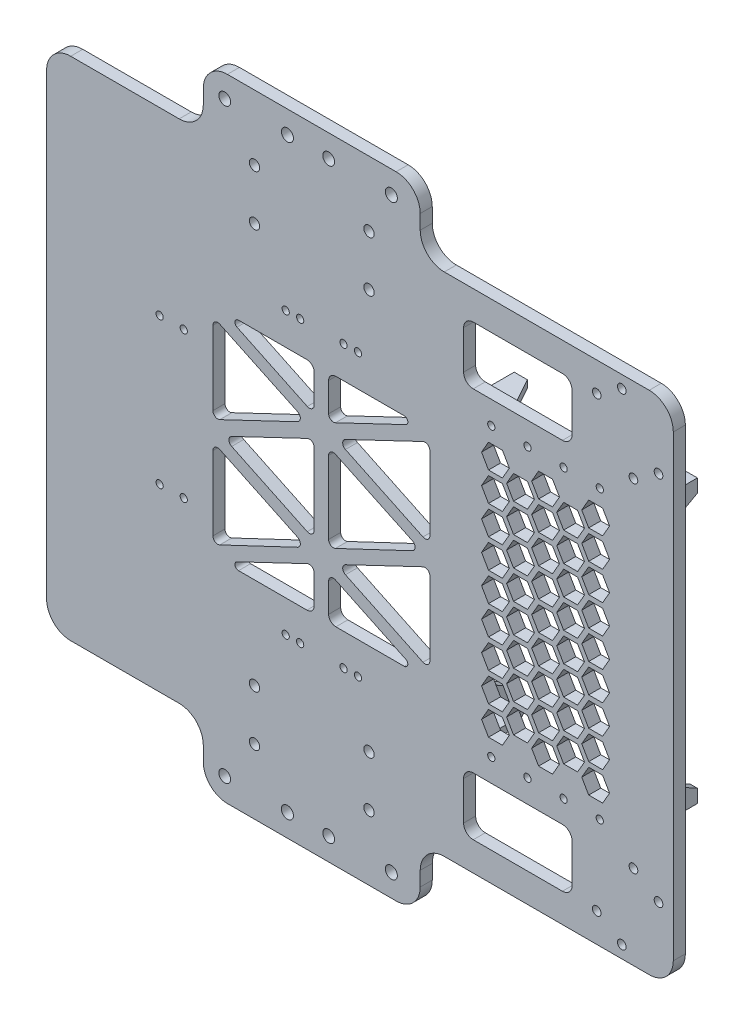
from build123d import *

# Parameters (mm, degrees)
EXTRUDE_1_DEPTH       = 5
EXTRUDE_2_DEPTH       = 20
CUT_EXTRUDE_3_DEPTH   = 10
CUT_EXTRUDE_4_DEPTH   = 10
MIRROR_2_COPY_1_DEPTH = 20
MIRROR_2_COPY_2_DEPTH = 10
MIRROR_2_COPY_3_DEPTH = 10
MIRROR_2_COPY_4_DEPTH = 20
MIRROR_2_COPY_5_DEPTH = 10
MIRROR_2_COPY_6_DEPTH = 10
CUT_EXTRUDE_5_DEPTH   = 5
SKETCH_9_W            = 45
SKETCH_9_H            = 24
CUT_EXTRUDE_6_DEPTH   = 5
FILLET_1_R            = 4
FILLET_2_R            = 1.5
FILLET_3_R            = 2
FILLET_4_R            = 3
SKETCH_10_R           = 1.8
SKETCH_10_R_2         = 2.5
SKETCH_10_R_3         = 2.45
SKETCH_10_R_4         = 1.5
SKETCH_10_R_5         = 2.15
CUT_EXTRUDE_7_DEPTH   = 186.636742053


with BuildPart() as part:
    # 草图1 → 凸台-拉伸1 (new body)
    with BuildSketch(Plane.XY):
        with BuildLine():
            Line((-130, 95), (-130, -95))
            ThreePointArc((-130, -95), (-127.071067812, -102.071067812), (-120, -105))
            Line((-120, -105), (-75, -105))
            ThreePointArc((-75, -105), (-67.928932188, -107.928932188), (-65, -115))
            Line((-65, -115), (-65, -121))
            ThreePointArc((-65, -121), (-62.071067812, -128.071067812), (-55, -131))
            Line((-55, -131), (15, -131))
            ThreePointArc((15, -131), (22.071067812, -128.071067812), (25, -121))
            Line((25, -121), (25, -115))
            ThreePointArc((25, -115), (27.928932188, -107.928932188), (35, -105))
            Line((35, -105), (120, -105))
            ThreePointArc((120, -105), (127.071067812, -102.071067812), (130, -95))
            Line((130, -95), (130, 95))
            ThreePointArc((130, 95), (127.071067812, 102.071067812), (120, 105))
            Line((120, 105), (35, 105))
            ThreePointArc((35, 105), (27.928932188, 107.928932188), (25, 115))
            Line((25, 115), (25, 121))
            ThreePointArc((25, 121), (22.071067812, 128.071067812), (15, 131))
            Line((15, 131), (-55, 131))
            ThreePointArc((-55, 131), (-62.071067812, 128.071067812), (-65, 121))
            Line((-65, 121), (-65, 115))
            ThreePointArc((-65, 115), (-67.928932188, 107.928932188), (-75, 105))
            Line((-75, 105), (-120, 105))
            ThreePointArc((-120, 105), (-127.071067812, 102.071067812), (-130, 95))
        make_face()
    extrude(amount=EXTRUDE_1_DEPTH)

    # 草图4 → 凸台-拉伸2 (add)
    with BuildSketch(Plane(origin=(0, 0, 0), x_dir=(-1, 0, 0), z_dir=(0, 0, -1))):
        Polygon((-39, -47.5), (-39, -58.5), (-50, -58.5), (-50, -55.5), (-42, -55.5), (-42, -47.5), align=None)
    extrude_2 = extrude(amount=EXTRUDE_2_DEPTH)

    # 草图5 → 切除-拉伸3 (cut)
    with BuildSketch(Plane.XZ.offset(58.5)):
        Polygon((50, -10), (44.5, -20), (50, -20), align=None)
    cut_extrude_3 = extrude(amount=-CUT_EXTRUDE_3_DEPTH, mode=Mode.SUBTRACT)

    # 草图6 → 切除-拉伸4 (cut)
    with BuildSketch(Plane.ZY.offset(-39)):
        Polygon((-20, -53), (-10, -47.5), (-20, -47.5), align=None)
    cut_extrude_4 = extrude(amount=-CUT_EXTRUDE_4_DEPTH, mode=Mode.SUBTRACT)

    # 镜向1: 凸台-拉伸2, 切除-拉伸3, 切除-拉伸4 across plane
    add(extrude_2.mirror(Plane(origin=(77, 0, 0), x_dir=(0, 0, 1), z_dir=(1, 0, 0))))
    add(cut_extrude_3.mirror(Plane(origin=(77, 0, 0), x_dir=(0, 0, 1), z_dir=(1, 0, 0))), mode=Mode.SUBTRACT)
    add(cut_extrude_4.mirror(Plane(origin=(77, 0, 0), x_dir=(0, 0, 1), z_dir=(1, 0, 0))), mode=Mode.SUBTRACT)

    # 镜向2 copy 1 sketch → 镜向2 copy 1 (add)
    with BuildSketch(Plane(origin=(154, 0, 0), x_dir=(1, 0, 0), z_dir=(0, 0, -1))):
        Polygon((-39, -47.5), (-39, -58.5), (-50, -58.5), (-50, -55.5), (-42, -55.5), (-42, -47.5), align=None)
    extrude(amount=MIRROR_2_COPY_1_DEPTH)

    # 镜向2 copy 2 sketch → 镜向2 copy 2 (cut)
    with BuildSketch(Plane(origin=(154, 58.5, 0), x_dir=(-1, 0, 0), z_dir=(0, 1, 0))):
        Polygon((50, -10), (44.5, -20), (50, -20), align=None)
    extrude(amount=-MIRROR_2_COPY_2_DEPTH, mode=Mode.SUBTRACT)

    # 镜向2 copy 3 sketch → 镜向2 copy 3 (cut)
    with BuildSketch(Plane(origin=(115, 0, 0), x_dir=(0, 0, 1), z_dir=(1, 0, 0))):
        Polygon((-20, -53), (-10, -47.5), (-20, -47.5), align=None)
    extrude(amount=-MIRROR_2_COPY_3_DEPTH, mode=Mode.SUBTRACT)

    # 镜向2 copy 4 sketch → 镜向2 copy 4 (add)
    with BuildSketch(Plane(origin=(0, 0, 0), x_dir=(-1, 0, 0), z_dir=(0, 0, -1))):
        Polygon((-39, 47.5), (-39, 58.5), (-50, 58.5), (-50, 55.5), (-42, 55.5), (-42, 47.5), align=None)
    extrude(amount=MIRROR_2_COPY_4_DEPTH)

    # 镜向2 copy 5 sketch → 镜向2 copy 5 (cut)
    with BuildSketch(Plane(origin=(0, 58.5, 0), x_dir=(1, 0, 0), z_dir=(0, 1, 0))):
        Polygon((50, 10), (44.5, 20), (50, 20), align=None)
    extrude(amount=-MIRROR_2_COPY_5_DEPTH, mode=Mode.SUBTRACT)

    # 镜向2 copy 6 sketch → 镜向2 copy 6 (cut)
    with BuildSketch(Plane.ZY.offset(-39)):
        Polygon((-20, 53), (-10, 47.5), (-20, 47.5), align=None)
    extrude(amount=-MIRROR_2_COPY_6_DEPTH, mode=Mode.SUBTRACT)

    # 草图7 → 切除-拉伸5 (cut)
    with BuildSketch(Plane(origin=(0, 0, 0), x_dir=(-1, 0, 0), z_dir=(0, 0, -1))):
        Polygon((-92.012994616, 36), (-94.899745962, 41), (-100.673248654, 41), (-103.56, 36), (-100.673248654, 31), (-94.899745962, 31), align=None)
        Polygon((-74.115136271, 31), (-71.228384925, 36), (-74.115136271, 41), (-79.888638963, 41), (-82.775390309, 36), (-79.888638963, 31), align=None)
        Polygon((-92.012994616, 24), (-94.899745962, 29), (-100.673248654, 29), (-103.56, 24), (-100.673248654, 19), (-94.899745962, 19), align=None)
        Polygon((-93.167695155, 30), (-90.280943809, 25), (-84.507441117, 25), (-81.620689771, 30), (-84.507441117, 35), (-90.280943809, 35), align=None)
        Polygon((-84.507441117, 37), (-81.620689771, 42), (-84.507441117, 47), (-90.280943809, 47), (-93.167695155, 42), (-90.280943809, 37), align=None)
        Polygon((-79.888638963, 43), (-74.115136271, 43), (-71.228384925, 48), (-74.115136271, 53), (-79.888638963, 53), (-82.775390309, 48), align=None)
        Polygon((-94.899745962, 43), (-92.012994616, 48), (-94.899745962, 53), (-100.673248654, 53), (-103.56, 48), (-100.673248654, 43), align=None)
        Polygon((-72.383085464, 42), (-69.496334118, 37), (-63.722831426, 37), (-60.83608008, 42), (-63.722831426, 47), (-69.496334118, 47), align=None)
        Polygon((-93.167695155, 18), (-90.280943809, 13), (-84.507441117, 13), (-81.620689771, 18), (-84.507441117, 23), (-90.280943809, 23), align=None)
        Polygon((-74.115136271, 19), (-71.228384925, 24), (-74.115136271, 29), (-79.888638963, 29), (-82.775390309, 24), (-79.888638963, 19), align=None)
        Polygon((-72.383085464, 30), (-69.496334118, 25), (-63.722831426, 25), (-60.83608008, 30), (-63.722831426, 35), (-69.496334118, 35), align=None)
        Polygon((-92.012994616, 12), (-94.899745962, 17), (-100.673248654, 17), (-103.56, 12), (-100.673248654, 7), (-94.899745962, 7), align=None)
        Polygon((-93.167695155, 6), (-90.280943809, 1), (-84.507441117, 1), (-81.620689771, 6), (-84.507441117, 11), (-90.280943809, 11), align=None)
        Polygon((-74.115136271, 7), (-71.228384925, 12), (-74.115136271, 17), (-79.888638963, 17), (-82.775390309, 12), (-79.888638963, 7), align=None)
        Polygon((-72.383085464, 18), (-69.496334118, 13), (-63.722831426, 13), (-60.83608008, 18), (-63.722831426, 23), (-69.496334118, 23), align=None)
        Polygon((-92.012994616, 0), (-94.899745962, 5), (-100.673248654, 5), (-103.56, 0), (-100.673248654, -5), (-94.899745962, -5), align=None)
        Polygon((-93.167695155, -6), (-90.280943809, -11), (-84.507441117, -11), (-81.620689771, -6), (-84.507441117, -1), (-90.280943809, -1), align=None)
        Polygon((-74.115136271, -5), (-71.228384925, 0), (-74.115136271, 5), (-79.888638963, 5), (-82.775390309, 0), (-79.888638963, -5), align=None)
        Polygon((-72.383085464, 6), (-69.496334118, 1), (-63.722831426, 1), (-60.83608008, 6), (-63.722831426, 11), (-69.496334118, 11), align=None)
        Polygon((-92.012994616, -12), (-94.899745962, -7), (-100.673248654, -7), (-103.56, -12), (-100.673248654, -17), (-94.899745962, -17), align=None)
        Polygon((-93.167695155, -18), (-90.280943809, -23), (-84.507441117, -23), (-81.620689771, -18), (-84.507441117, -13), (-90.280943809, -13), align=None)
        Polygon((-74.115136271, -17), (-71.228384925, -12), (-74.115136271, -7), (-79.888638963, -7), (-82.775390309, -12), (-79.888638963, -17), align=None)
        Polygon((-72.383085464, -6), (-69.496334118, -11), (-63.722831426, -11), (-60.83608008, -6), (-63.722831426, -1), (-69.496334118, -1), align=None)
        Polygon((-92.012994616, -24), (-94.899745962, -19), (-100.673248654, -19), (-103.56, -24), (-100.673248654, -29), (-94.899745962, -29), align=None)
        Polygon((-93.167695155, -30), (-90.280943809, -35), (-84.507441117, -35), (-81.620689771, -30), (-84.507441117, -25), (-90.280943809, -25), align=None)
        Polygon((-74.115136271, -29), (-71.228384925, -24), (-74.115136271, -19), (-79.888638963, -19), (-82.775390309, -24), (-79.888638963, -29), align=None)
        Polygon((-72.383085464, -18), (-69.496334118, -23), (-63.722831426, -23), (-60.83608008, -18), (-63.722831426, -13), (-69.496334118, -13), align=None)
        Polygon((-92.012994616, -36), (-94.899745962, -31), (-100.673248654, -31), (-103.56, -36), (-100.673248654, -41), (-94.899745962, -41), align=None)
        Polygon((-93.167695155, -42), (-90.280943809, -47), (-84.507441117, -47), (-81.620689771, -42), (-84.507441117, -37), (-90.280943809, -37), align=None)
        Polygon((-74.115136271, -41), (-71.228384925, -36), (-74.115136271, -31), (-79.888638963, -31), (-82.775390309, -36), (-79.888638963, -41), align=None)
        Polygon((-72.383085464, -30), (-69.496334118, -35), (-63.722831426, -35), (-60.83608008, -30), (-63.722831426, -25), (-69.496334118, -25), align=None)
        Polygon((-92.012994616, -48), (-94.899745962, -43), (-100.673248654, -43), (-103.56, -48), (-100.673248654, -53), (-94.899745962, -53), align=None)
        Polygon((-74.115136271, -53), (-71.228384925, -48), (-74.115136271, -43), (-79.888638963, -43), (-82.775390309, -48), (-79.888638963, -53), align=None)
        Polygon((-72.383085464, -42), (-69.496334118, -47), (-63.722831426, -47), (-60.83608008, -42), (-63.722831426, -37), (-69.496334118, -37), align=None)
        Polygon((-61.990780618, 36), (-59.104029272, 31), (-53.330526581, 31), (-50.443775235, 36), (-53.330526581, 41), (-59.104029272, 41), align=None)
        Polygon((-61.990780618, 48), (-59.104029272, 43), (-53.330526581, 43), (-50.443775235, 48), (-53.330526581, 53), (-59.104029272, 53), align=None)
        Polygon((-61.990780618, 24), (-59.104029272, 19), (-53.330526581, 19), (-50.443775235, 24), (-53.330526581, 29), (-59.104029272, 29), align=None)
        Polygon((-61.990780618, 12), (-59.104029272, 7), (-53.330526581, 7), (-50.443775235, 12), (-53.330526581, 17), (-59.104029272, 17), align=None)
        Polygon((-61.990780618, 0), (-59.104029272, -5), (-53.330526581, -5), (-50.443775235, 0), (-53.330526581, 5), (-59.104029272, 5), align=None)
        Polygon((-61.990780618, -12), (-59.104029272, -17), (-53.330526581, -17), (-50.443775235, -12), (-53.330526581, -7), (-59.104029272, -7), align=None)
        Polygon((-61.990780618, -24), (-59.104029272, -29), (-53.330526581, -29), (-50.443775235, -24), (-53.330526581, -19), (-59.104029272, -19), align=None)
        Polygon((-61.990780618, -36), (-59.104029272, -41), (-53.330526581, -41), (-50.443775235, -36), (-53.330526581, -31), (-59.104029272, -31), align=None)
        Polygon((-61.990780618, -48), (-59.104029272, -53), (-53.330526581, -53), (-50.443775235, -48), (-53.330526581, -43), (-59.104029272, -43), align=None)
    extrude(amount=-CUT_EXTRUDE_5_DEPTH, mode=Mode.SUBTRACT)

    # 草图9 → 切除-拉伸6 (cut)
    with BuildSketch(Plane(origin=(0, 0, 0), x_dir=(-1, 0, 0), z_dir=(0, 0, -1))):
        Polygon((9.804878049, 22.5), (-29, 41), (-29, 4), align=None)
        Polygon((13, -26.88372093), (-25, -45), (13, -45), align=None)
        Polygon((22.074593576, -22.557461202), (61, -41), (61, -4), align=None)
        Polygon((19, 26.88372093), (57, 45), (19, 45), align=None)
        Polygon((19, -18.11627907), (57, 0), (19, 18.11627907), align=None)
        with Locations((-65.5, 81)):
            Rectangle(SKETCH_9_W, SKETCH_9_H)
        with Locations((-65.5, -81)):
            Rectangle(SKETCH_9_W, SKETCH_9_H)
        Polygon((13, 45), (-25, 45), (13, 26.88372093), align=None)
        Polygon((61, 4), (61, 41), (22.074593576, 22.557461202), align=None)
        Polygon((13, 18.257993079), (-25.535898385, 0), (13, -18.257993079), align=None)
        Polygon((19, -45), (57, -45), (19, -26.88372093), align=None)
        Polygon((-29, -41), (9.804878049, -22.5), (-29, -4), align=None)
    extrude(amount=-CUT_EXTRUDE_6_DEPTH, mode=Mode.SUBTRACT)

    # 圆角1
    fillet_1_edges = [part.edges().sort_by_distance(p)[0] for p in [
        (43, -93, 2.5),
        (88, -69, 2.5),
        (43, -69, 2.5),
        (88, -93, 2.5),
        (88, 69, 2.5),
        (43, 69, 2.5),
        (43, 93, 2.5),
        (88, 93, 2.5),
    ]]
    fillet(fillet_1_edges, radius=FILLET_1_R)

    # 圆角2
    fillet_2_edges = [part.edges().sort_by_distance(p)[0] for p in [
        (25, -45, 2.5),
        (-57, -45, 2.5),
        (25, 45, 2.5),
        (-57, 45, 2.5),
    ]]
    fillet(fillet_2_edges, radius=FILLET_2_R)

    # 圆角3
    fillet_3_edges = [part.edges().sort_by_distance(p)[0] for p in [
        (29, -4, 2.5),
        (29, 4, 2.5),
        (-13, -18.257993079, 2.5),
        (-61, -41, 2.5),
        (-61, 4, 2.5),
        (-13, -26.88372093, 2.5),
        (-13, 18.257993079, 2.5),
        (-61, -4, 2.5),
        (-22.074593576, -22.557461202, 2.5),
        (25.535898385, 0, 2.5),
        (-22.074593576, 22.557461202, 2.5),
        (-61, 41, 2.5),
        (-19, 26.88372093, 2.5),
        (-19, -26.88372093, 2.5),
        (-19, -18.11627907, 2.5),
        (29, -41, 2.5),
        (29, 41, 2.5),
        (-57, 0, 2.5),
        (-9.804878049, -22.5, 2.5),
        (-13, 26.88372093, 2.5),
        (-9.804878049, 22.5, 2.5),
        (-19, 18.11627907, 2.5),
    ]]
    fillet(fillet_3_edges, radius=FILLET_3_R)

    # 圆角4
    fillet_4_edges = [part.edges().sort_by_distance(p)[0] for p in [
        (-13, -45, 2.5),
        (-13, 45, 2.5),
        (-19, -45, 2.5),
        (-19, 45, 2.5),
    ]]
    fillet(fillet_4_edges, radius=FILLET_4_R)

    # 草图10 → 切除-拉伸7 (cut, through all)
    with BuildSketch(Plane(origin=(0, 0, 0), x_dir=(-1, 0, 0), z_dir=(0, 0, -1))):
        with Locations((-123.874270778, 76.959685144)):
            Circle(SKETCH_10_R)
        with Locations((-113.46869275, 70.033362462)):
            Circle(SKETCH_10_R)
        with Locations((-108.636360878, 99.851956806)):
            Circle(SKETCH_10_R)
        with Locations((-98.23078285, 92.925634125)):
            Circle(SKETCH_10_R)
        with Locations((-13.026746603, 121.678975654)):
            Circle(SKETCH_10_R_2)
        with Locations((56.094087389, 121.678975654)):
            Circle(SKETCH_10_R_3)
        with Locations((30.094087389, 121.678975654)):
            Circle(SKETCH_10_R_2)
        with Locations((12.973253397, 121.678975654)):
            Circle(SKETCH_10_R_3)
        with Locations((12.973253397, -121.678975654)):
            Circle(SKETCH_10_R_3)
        with Locations((30.094087389, -121.678975654)):
            Circle(SKETCH_10_R_2)
        with Locations((56.094087389, -121.678975654)):
            Circle(SKETCH_10_R_3)
        with Locations((-13.026746603, -121.678975654)):
            Circle(SKETCH_10_R_2)
        with Locations((-98.23078285, -92.925634125)):
            Circle(SKETCH_10_R)
        with Locations((-108.636360878, -99.851956806)):
            Circle(SKETCH_10_R)
        with Locations((-113.46869275, -70.033362462)):
            Circle(SKETCH_10_R)
        with Locations((-123.874270778, -76.959685144)):
            Circle(SKETCH_10_R)
        with Locations((-99.5, 59.5)):
            Circle(SKETCH_10_R_4)
        with Locations((-84.5, 59.5)):
            Circle(SKETCH_10_R_4)
        with Locations((-69.5, 59.5)):
            Circle(SKETCH_10_R_4)
        with Locations((-54.5, 59.5)):
            Circle(SKETCH_10_R_4)
        with Locations((0.806057342, 58.25)):
            Circle(SKETCH_10_R_4)
        with Locations((6.806057342, 58.25)):
            Circle(SKETCH_10_R_4)
        with Locations((24.806057342, 58.25)):
            Circle(SKETCH_10_R_4)
        with Locations((30.806057342, 58.25)):
            Circle(SKETCH_10_R_4)
        with Locations((30.806057342, -58.25)):
            Circle(SKETCH_10_R_4)
        with Locations((24.806057342, -58.25)):
            Circle(SKETCH_10_R_4)
        with Locations((6.806057342, -58.25)):
            Circle(SKETCH_10_R_4)
        with Locations((0.806057342, -58.25)):
            Circle(SKETCH_10_R_4)
        with Locations((-54.5, -59.5)):
            Circle(SKETCH_10_R_4)
        with Locations((-69.5, -59.5)):
            Circle(SKETCH_10_R_4)
        with Locations((-84.5, -59.5)):
            Circle(SKETCH_10_R_4)
        with Locations((-99.5, -59.5)):
            Circle(SKETCH_10_R_4)
        with Locations((73.101514825, 30.3)):
            Circle(SKETCH_10_R_4)
        with Locations((83.101514825, 30.3)):
            Circle(SKETCH_10_R_4)
        with Locations((83.101514825, -30.3)):
            Circle(SKETCH_10_R_4)
        with Locations((73.101514825, -30.3)):
            Circle(SKETCH_10_R_4)
        with Locations((43.75, 83)):
            Circle(SKETCH_10_R_5)
        with Locations((43.75, 104)):
            Circle(SKETCH_10_R_5)
        with Locations((-3.75, 83)):
            Circle(SKETCH_10_R_5)
        with Locations((-3.75, 104)):
            Circle(SKETCH_10_R_5)
        with Locations((-3.75, -104)):
            Circle(SKETCH_10_R_5)
        with Locations((-3.75, -83)):
            Circle(SKETCH_10_R_5)
        with Locations((43.75, -104)):
            Circle(SKETCH_10_R_5)
        with Locations((43.75, -83)):
            Circle(SKETCH_10_R_5)
    extrude(amount=-CUT_EXTRUDE_7_DEPTH, mode=Mode.SUBTRACT)


solid = part.part
